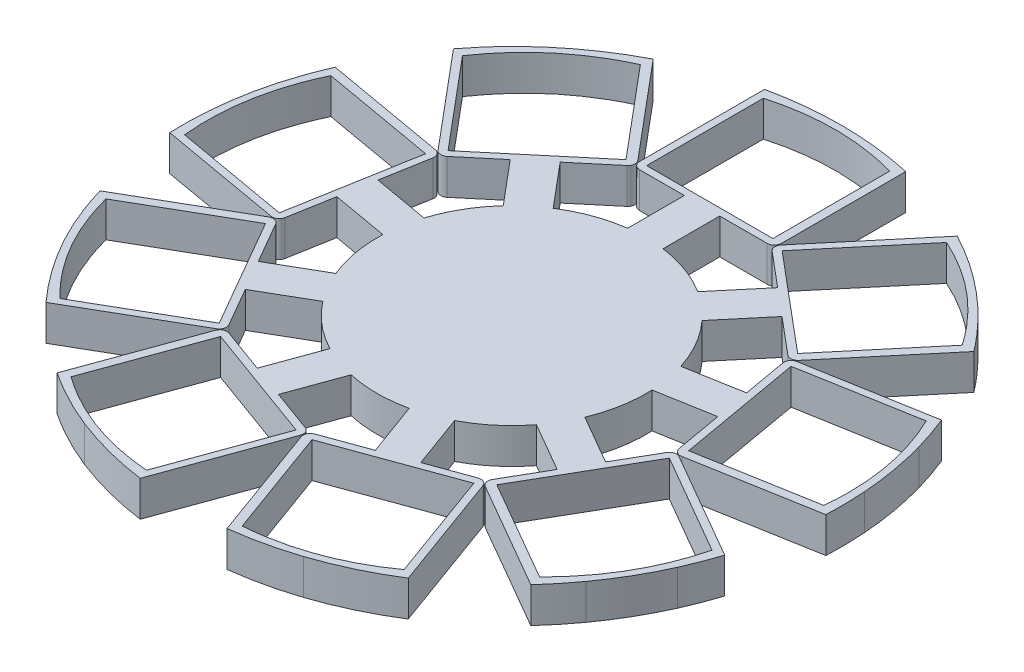
from build123d import *

# Parameters (mm, degrees)
BOSS_EXTRUDE2_DEPTH = 5
SKETCH4_R           = 3.65
CUT_EXTRUDE1_DEPTH  = 3


# Read off the part's stored shape, not the designer's step: Boss-Extrude2
with BuildPart() as part:
    # Boss-Extrude2 outline → Boss-Extrude2 (new body)
    with BuildSketch(Plane(origin=(0, 0, 0), x_dir=(1, 0, 0), z_dir=(0, 1, 0))):
        with BuildLine():
            ThreePointArc((-4.092652249, -18.553980639), (0, -19), (4.092652249, -18.553980639))
            Line((4.092652249, -18.553980639), (6.828813395, -26.071521606))
            Line((6.828813395, -26.071521606), (0.541216348, -28.360019776))
            ThreePointArc((0.541216348, -28.360019776), (-0.023071296, -28.877094135), (-0.05645613, -29.64173254))
            Line((-0.05645613, -29.64173254), (5.925713292, -46.077607948))
            add(Edge.make_bspline(
                [(14.726462377, -44.106476915), (10.477080583, -45.512147737), (5.925713292, -46.077607948)],
                knots=[0.552368255, 0.552368255, 0.552368255, 0.999798381, 0.999798381, 0.999798381], degree=2))
            ThreePointArc((14.726462377, -44.106476915), (19.887186523, -42.032723112), (24.763401083, -39.357641784))
            Line((24.763401083, -39.357641784), (18.737396286, -22.801329674))
            ThreePointArc((18.737396286, -22.801329674), (18.220321927, -22.23704203), (17.455683522, -22.203657196))
            Line((17.455683522, -22.203657196), (11.527276499, -24.361420889))
            Line((11.527276499, -24.361420889), (8.791115353, -16.843879923))
            ThreePointArc((8.791115353, -16.843879923), (12.212964584, -14.554844419), (15.061422378, -11.58246761))
            Line((15.061422378, -11.58246761), (21.989625608, -15.58246761))
            Line((21.989625608, -15.58246761), (18.644065098, -21.377148394))
            ThreePointArc((18.644065098, -21.377148394), (18.544164676, -22.135967439), (19.010090502, -22.743173798))
            Line((19.010090502, -22.743173798), (34.195568391, -31.51051147))
            add(Edge.make_bspline(
                [(37.696676331, -27.225183078), (36.086953236, -29.449558781), (34.195568391, -31.51051147)],
                knots=[0.726621134, 0.726621134, 0.726621134, 0.999801746, 0.999801746, 0.999801746], degree=2))
            ThreePointArc((37.696676331, -27.225183078), (40.270444041, -23.249544871), (42.426468554, -19.032728811))
            add(Edge.make_bspline(
                [(44.267229752, -14.235953431), (43.468250472, -16.704779402), (42.426468554, -19.032728811)],
                knots=[0, 0, 0, 0.253637017, 0.253637017, 0.253637017], degree=2))
            ThreePointArc((44.267229752, -14.235953431), (44.267850057, -14.234024425), (44.268470278, -14.232095393))
            Line((44.268470278, -14.232095393), (29.010090502, -5.422665722))
            ThreePointArc((29.010090502, -5.422665722), (28.251271457, -5.3227653), (27.644065098, -5.788691126))
            Line((27.644065098, -5.788691126), (24.489625608, -11.252340591))
            Line((24.489625608, -11.252340591), (17.561422378, -7.252340591))
            ThreePointArc((17.561422378, -7.252340591), (18.711347307, -3.299315376), (18.982785588, 0.808610738))
            Line((18.982785588, 0.808610738), (26.861247612, 2.19779616))
            Line((26.861247612, 2.19779616), (28.023148584, -4.391671698))
            ThreePointArc((28.023148584, -4.391671698), (28.4343799, -5.037175564), (29.181604514, -5.202831273))
            Line((29.181604514, -5.202831273), (46.449893715, -2.157964642))
            add(Edge.make_bspline(
                [(46.377339287, 3.375263046), (46.574021845, 0.636580742), (46.449893715, -2.157964642)],
                knots=[0.726674569, 0.726674569, 0.726674569, 0.999855051, 0.999855051, 0.999855051], degree=2))
            ThreePointArc((46.377339287, 3.375263046), (45.793469752, 8.075154985), (44.734566159, 12.691280098))
            add(Edge.make_bspline(
                [(43.060948618, 17.550062796), (44.036092006, 15.14475979), (44.734566159, 12.691280098)],
                knots=[0, 0, 0, 0.253691366, 0.253691366, 0.253691366], degree=2))
            ThreePointArc((43.060948618, 17.550062796), (43.060389451, 17.551434709), (43.05983024, 17.552806605))
            Line((43.05983024, 17.552806605), (25.708640961, 14.493323787))
            ThreePointArc((25.708640961, 14.493323787), (25.063137094, 14.082092471), (24.897481386, 13.334867857))
            Line((24.897481386, 13.334867857), (25.993006724, 7.121834925))
            Line((25.993006724, 7.121834925), (18.1145447, 5.732649503))
            ThreePointArc((18.1145447, 5.732649503), (16.454482672, 9.5), (14.021892451, 12.821331136))
            Line((14.021892451, 12.821331136), (19.164193328, 18.949686681))
            Line((19.164193328, 18.949686681), (24.289889404, 14.648716994))
            ThreePointArc((24.289889404, 14.648716994), (25.019832756, 14.418566739), (25.698721457, 14.771973827))
            Line((25.698721457, 14.771973827), (36.969798491, 28.204321315))
            add(Edge.make_bspline(
                [(33.357518889, 32.396387662), (35.268579945, 30.424859446), (36.969798491, 28.204321315)],
                knots=[0.726753062, 0.726753062, 0.726753062, 0.999933347, 0.999933347, 0.999933347], degree=2))
            ThreePointArc((33.357518889, 32.396387662), (29.889226695, 35.621399854), (26.110883391, 38.476899154))
            add(Edge.make_bspline(
                [(21.704222056, 41.123919377), (23.998094584, 39.907850894), (26.110883391, 38.476899154)],
                knots=[0, 0, 0, 0.253771194, 0.253771194, 0.253771194], degree=2))
            ThreePointArc((21.704222056, 41.123919377), (21.703619568, 41.12423735), (21.703017076, 41.124555314))
            Line((21.703017076, 41.124555314), (10.377832595, 27.627726021))
            ThreePointArc((10.377832595, 27.627726021), (10.14768234, 26.897782669), (10.501089428, 26.218893968))
            Line((10.501089428, 26.218893968), (15.333971113, 22.163624729))
            Line((15.333971113, 22.163624729), (10.191670235, 16.035269184))
            ThreePointArc((10.191670235, 16.035269184), (6.498382723, 17.854159795), (2.5, 18.834808202))
            Line((2.5, 18.834808202), (2.5, 26.834808202))
            Line((2.5, 26.834808202), (9.191121021, 26.834808202))
            ThreePointArc((9.191121021, 26.834808202), (9.898227802, 27.127701421), (10.191121021, 27.834808202))
            Line((10.191121021, 27.834808202), (10.191121021, 45.369494733))
            add(Edge.make_bspline(
                [(4.729337103, 46.258873425), (7.460570781, 45.977002255), (10.191121021, 45.369494733)],
                knots=[0.726819887, 0.726819887, 0.726819887, 1, 1, 1], degree=2))
            ThreePointArc((4.729337103, 46.258873425), (-0.000514856, 46.499999997), (-4.730361475, 46.258768686))
            add(Edge.make_bspline(
                [(-9.808878979, 45.453667544), (-7.269325183, 45.996797591), (-4.730361475, 46.258768686)],
                knots=[0, 0, 0, 0.253839147, 0.253839147, 0.253839147], degree=2))
            Line((-9.808878979, 45.453667544), (-9.808878979, 27.834808202))
            ThreePointArc((-9.808878979, 27.834808202), (-9.51598576, 27.127701421), (-8.808878979, 26.834808202))
            Line((-8.808878979, 26.834808202), (-2.5, 26.834808202))
            Line((-2.5, 26.834808202), (-2.5, 18.834808202))
            ThreePointArc((-2.5, 18.834808202), (-6.498382723, 17.854159795), (-10.191670235, 16.035269184))
            Line((-10.191670235, 16.035269184), (-15.333971113, 22.163624729))
            Line((-15.333971113, 22.163624729), (-10.208275037, 26.464594416))
            ThreePointArc((-10.208275037, 26.464594416), (-9.854867948, 27.143483116), (-10.085018203, 27.873426469))
            Line((-10.085018203, 27.873426469), (-21.356097445, 41.305775648))
            ThreePointArc((-21.356097445, 41.305775648), (-27.134146549, 37.762257494), (-32.335663307, 33.416386377))
            add(Edge.make_bspline(
                [(-36.702055138, 28.479899323), (-34.675783099, 31.136682077), (-32.335663307, 33.416386377)],
                knots=[2.3779e-05, 2.3779e-05, 2.3779e-05, 0.32571904, 0.32571904, 0.32571904], degree=2))
            Line((-36.702055138, 28.479899323), (-25.405907066, 15.017674275))
            ThreePointArc((-25.405907066, 15.017674275), (-24.727018365, 14.664267187), (-23.997075013, 14.894417442))
            Line((-23.997075013, 14.894417442), (-19.164193328, 18.949686681))
            Line((-19.164193328, 18.949686681), (-14.021892451, 12.821331136))
            ThreePointArc((-14.021892451, 12.821331136), (-16.454482672, 9.5), (-18.114544699, 5.732649503))
            Line((-18.114544699, 5.732649503), (-25.993006724, 7.121834925))
            Line((-25.993006724, 7.121834925), (-24.831105752, 13.711302782))
            ThreePointArc((-24.831105752, 13.711302782), (-24.996761461, 14.458527396), (-25.642265327, 14.869758713))
            Line((-25.642265327, 14.869758713), (-42.778467193, 17.891333449))
            add(Edge.make_bspline(
                [(-45.60750834, 9.066707399), (-44.693060387, 13.569205593), (-42.778467193, 17.891333449)],
                knots=[0.540669898, 0.540669898, 0.540669898, 0.999993667, 0.999993667, 0.999993667], degree=2))
            ThreePointArc((-45.60750834, 9.066707399), (-46.35454477, 3.675075394), (-46.46641816, -1.76691353))
            Line((-46.46641816, -1.76691353), (-29.115228881, -4.826396347))
            ThreePointArc((-29.115228881, -4.826396347), (-28.368004266, -4.660740639), (-27.95677295, -4.015236772))
            Line((-27.95677295, -4.015236772), (-26.861247612, 2.19779616))
            Line((-26.861247612, 2.19779616), (-18.982785588, 0.808610738))
            ThreePointArc((-18.982785588, 0.808610738), (-18.711347307, -3.299315376), (-17.561422378, -7.252340591))
            Line((-17.561422378, -7.252340591), (-24.489625608, -11.252340591))
            Line((-24.489625608, -11.252340591), (-27.835186119, -5.457659808))
            ThreePointArc((-27.835186119, -5.457659808), (-28.442392478, -4.991733982), (-29.201211523, -5.091634404))
            Line((-29.201211523, -5.091634404), (-44.263628319, -13.787924795))
            add(Edge.make_bspline(
                [(-40.763318684, -22.3741335), (-42.957967983, -18.335375474), (-44.263628319, -13.787924795)],
                knots=[0.540389723, 0.540389723, 0.540389723, 0.999923643, 0.999923643, 0.999923643], degree=2))
            ThreePointArc((-40.763318684, -22.3741335), (-37.870712156, -26.982571427), (-34.459591298, -31.221572151))
            Line((-34.459591298, -31.221572151), (-19.201211523, -22.41214248))
            ThreePointArc((-19.201211523, -22.41214248), (-18.735285696, -21.804936121), (-18.835186119, -21.046117076))
            Line((-18.835186119, -21.046117076), (-21.989625608, -15.58246761))
            Line((-21.989625608, -15.58246761), (-15.061422378, -11.58246761))
            ThreePointArc((-15.061422378, -11.58246761), (-12.212964584, -14.554844419), (-8.791115353, -16.843879923))
            Line((-8.791115353, -16.843879923), (-11.527276499, -24.361420889))
            Line((-11.527276499, -24.361420889), (-17.814873547, -22.072922719))
            ThreePointArc((-17.814873547, -22.072922719), (-18.579511952, -22.106307552), (-19.096586311, -22.670595196))
            Line((-19.096586311, -22.670595196), (-25.057377793, -39.047735194))
            add(Edge.make_bspline(
                [(-16.908123924, -43.317032971), (-21.15210062, -41.642064819), (-25.057377793, -39.047735194)],
                knots=[0.543719133, 0.543719133, 0.543719133, 0.999846518, 0.999846518, 0.999846518], degree=2))
            ThreePointArc((-16.908123924, -43.317032971), (-11.699527864, -45.004122564), (-6.328738693, -46.067310173))
            Line((-6.328738693, -46.067310173), (-0.302733895, -29.510998063))
            ThreePointArc((-0.302733895, -29.510998063), (-0.336118729, -28.746359658), (-0.900406373, -28.229285299))
            Line((-0.900406373, -28.229285299), (-6.828813395, -26.071521606))
            Line((-6.828813395, -26.071521606), (-4.092652249, -18.553980639))
        make_face()
        with BuildLine():
            Line((-1.242426516, -29.168977919), (-6.873233872, -44.639493983))
            add(Edge.make_bspline(
                [(-6.873233872, -44.639493983), (-16.087098989, -43.930211896), (-23.608106034, -38.548498642)],
                knots=[0, 0, 0, 1, 1, 1], degree=2))
            Line((-23.608106034, -38.548498642), (-17.977298678, -23.077982578))
            Line((-17.977298678, -23.077982578), (-1.242426516, -29.168977919))
        make_face(mode=Mode.SUBTRACT)
        with BuildLine():
            Line((-19.701211523, -21.546117076), (-33.958916249, -29.777806738))
            add(Edge.make_bspline(
                [(-33.958916249, -29.777806738), (-40.561228684, -23.311906803), (-42.863355739, -14.354865129)],
                knots=[0, 0, 0, 1, 1, 1], degree=2))
            Line((-42.863355739, -14.354865129), (-28.605651012, -6.123175467))
            Line((-28.605651012, -6.123175467), (-19.701211523, -21.546117076))
        make_face(mode=Mode.SUBTRACT)
        with BuildLine():
            Line((17.797703665, -23.143349817), (23.428511021, -38.613865881))
            add(Edge.make_bspline(
                [(23.428511021, -38.613865881), (15.914363112, -43.993082614), (6.69363886, -44.704861222)],
                knots=[0, 0, 0, 1, 1, 1], degree=2))
            Line((6.69363886, -44.704861222), (1.062831504, -29.234345158))
            Line((1.062831504, -29.234345158), (17.797703665, -23.143349817))
        make_face(mode=Mode.SUBTRACT)
        with BuildLine():
            Line((28.510090502, -6.288691126), (42.767795229, -14.520380788))
            add(Edge.make_bspline(
                [(42.767795229, -14.520380788), (40.469317844, -23.471101048), (33.863355739, -29.943322397)],
                knots=[0, 0, 0, 1, 1, 1], degree=2))
            Line((33.863355739, -29.943322397), (19.605651012, -21.711632735))
            Line((19.605651012, -21.711632735), (28.510090502, -6.288691126))
        make_face(mode=Mode.SUBTRACT)
        with BuildLine():
            Line((-28.941580703, -3.841588594), (-45.154844302, -0.982752777))
            add(Edge.make_bspline(
                [(-45.154844302, -0.982752777), (-46.05630869, 8.214298567), (-42.062364921, 16.555569315)],
                knots=[0, 0, 0, 1, 1, 1], degree=2))
            Line((-42.062364921, 16.555569315), (-25.849101322, 13.696733497))
            Line((-25.849101322, 13.696733497), (-28.941580703, -3.841588594))
        make_face(mode=Mode.SUBTRACT)
        with BuildLine():
            Line((-24.639862622, 15.660461885), (-35.222318865, 28.272142131))
            add(Edge.make_bspline(
                [(-35.222318865, 28.272142131), (-30.001130002, 35.896942345), (-21.579926085, 39.719468881)],
                knots=[0, 0, 0, 1, 1, 1], degree=2))
            Line((-21.579926085, 39.719468881), (-10.997469842, 27.107788635))
            Line((-10.997469842, 27.107788635), (-24.639862622, 15.660461885))
        make_face(mode=Mode.SUBTRACT)
        with BuildLine():
            Line((25.882289139, 13.508516034), (42.095552738, 16.367351852))
            add(Edge.make_bspline(
                [(42.095552738, 16.367351852), (46.08822899, 8.033269551), (45.188032119, -1.170970239)],
                knots=[0, 0, 0, 1, 1, 1], degree=2))
            Line((45.188032119, -1.170970239), (28.97476852, -4.029806057))
            Line((28.97476852, -4.029806057), (25.882289139, 13.508516034))
        make_face(mode=Mode.SUBTRACT)
        with BuildLine():
            Line((11.143877038, 26.984938412), (21.726333281, 39.596618658))
            add(Edge.make_bspline(
                [(21.726333281, 39.596618658), (30.141945578, 35.778784047), (35.368726061, 28.149291907)],
                knots=[0, 0, 0, 1, 1, 1], degree=2))
            Line((35.368726061, 28.149291907), (24.786269818, 15.537611661))
            Line((24.786269818, 15.537611661), (11.143877038, 26.984938412))
        make_face(mode=Mode.SUBTRACT)
        with BuildLine():
            Line((-8.808878979, 27.834808202), (-8.808878979, 44.298187526))
            add(Edge.make_bspline(
                [(-8.808878979, 44.298187526), (0.09191084, 46.78300785), (9, 44.298187526)],
                knots=[0, 0, 0, 1, 1, 1], degree=2))
            Line((9, 44.298187526), (9, 27.834808202))
            Line((9, 27.834808202), (-8.808878979, 27.834808202))
        make_face(mode=Mode.SUBTRACT)
    extrude(amount=BOSS_EXTRUDE2_DEPTH)

    # Sketch4 → Cut-Extrude1 (cut)
    with BuildSketch(Plane.XZ):
        with BuildLine():
            ThreePointArc((-0.12727782, 18.643731685), (-1.494274897, 18.103635446), (-2.122961994, 16.775050677))
            Line((-2.122961994, 16.775050677), (-3.1, 1.926784887))
            ThreePointArc((-3.1, 1.926784887), (0, 3.65), (3.1, 1.926784887))
            Line((3.1, 1.926784887), (2.122961994, 16.775050677))
            ThreePointArc((2.122961994, 16.775050677), (1.494274897, 18.103635446), (0.12727782, 18.643731685))
            Line((0.12727782, 18.643731685), (-0.12727782, 18.643731685))
        make_face()
        Circle(SKETCH4_R)
        with BuildLine():
            ThreePointArc((3.1, -1.926784887), (0, -3.65), (-3.1, -1.926784887))
            Line((-3.1, -1.926784887), (-2.122961994, -16.775050677))
            ThreePointArc((-2.122961994, -16.775050677), (-1.494274897, -18.103635446), (-0.12727782, -18.643731685))
            Line((-0.12727782, -18.643731685), (0.12727782, -18.643731685))
            ThreePointArc((0.12727782, -18.643731685), (1.494274897, -18.103635446), (2.122961994, -16.775050677))
            Line((2.122961994, -16.775050677), (3.1, -1.926784887))
        make_face()
    extrude(amount=-CUT_EXTRUDE1_DEPTH, mode=Mode.SUBTRACT)


solid = part.part
